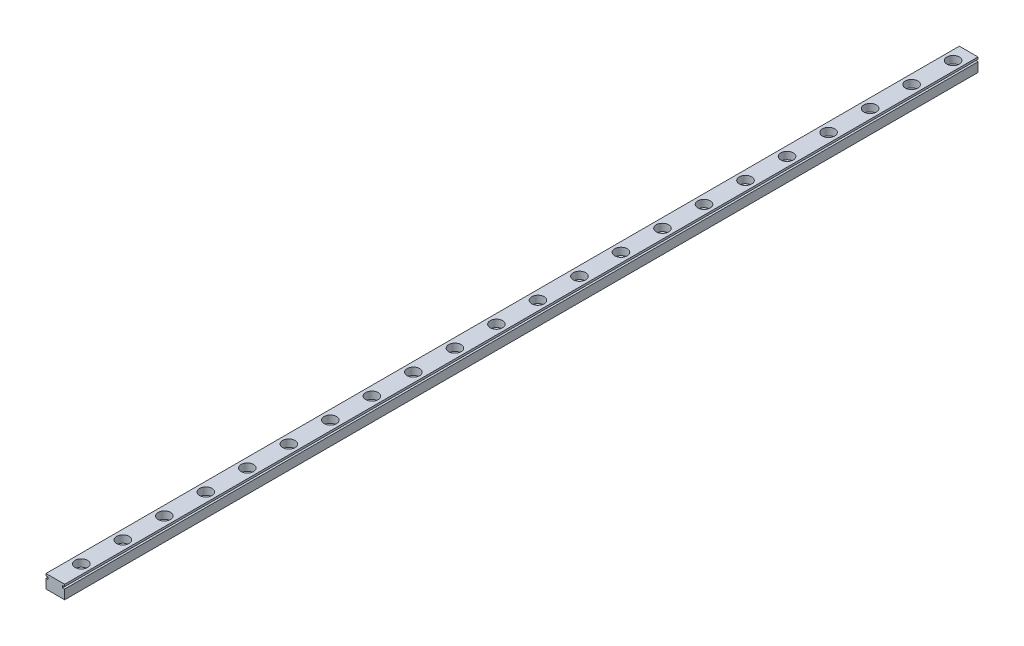
from build123d import *

# Parameters (mm, degrees)
EXTRUDE_1_DEPTH        = 440
PATTERN_LINEAR_1_COUNT = 22
PATTERN_LINEAR_1_PITCH = 20


with BuildPart() as part:
    # 草图1 → 凸台-拉伸1 (new body)
    with BuildSketch(Plane.XY):
        Polygon((-4.5, 0), (4.5, 0), (4.5, 4.5), (3.5, 4.5), (3.5, 5.5), (4.5, 5.5), (4.5, 6.5), (-4.5, 6.5), (-4.5, 5.5), (-3.5, 5.5), (-3.5, 4.5), (-4.5, 4.5), align=None)
    extrude(amount=EXTRUDE_1_DEPTH)

    # 草图2 → 切除-旋转1 (revolve, cut)
    with BuildSketch(Plane(origin=(0, 0, 0), x_dir=(0, 0, -1), z_dir=(1, 0, 0))):
        Polygon((-7.5, 0), (-6, 0), (-6, 3), (-4.5, 3), (-4.5, 6.5), (-7.5, 6.5), align=None)
    cut_revolve_1 = revolve(axis=Axis((0, 7.615907336, 7.5), (0, -1, 0)), mode=Mode.SUBTRACT)

    # 阵列(线性)1: 切除-旋转1 ×22
    with Locations(*[(0, 0, i * PATTERN_LINEAR_1_PITCH) for i in range(1, PATTERN_LINEAR_1_COUNT)]):
        add(cut_revolve_1, mode=Mode.SUBTRACT)


solid = part.part
